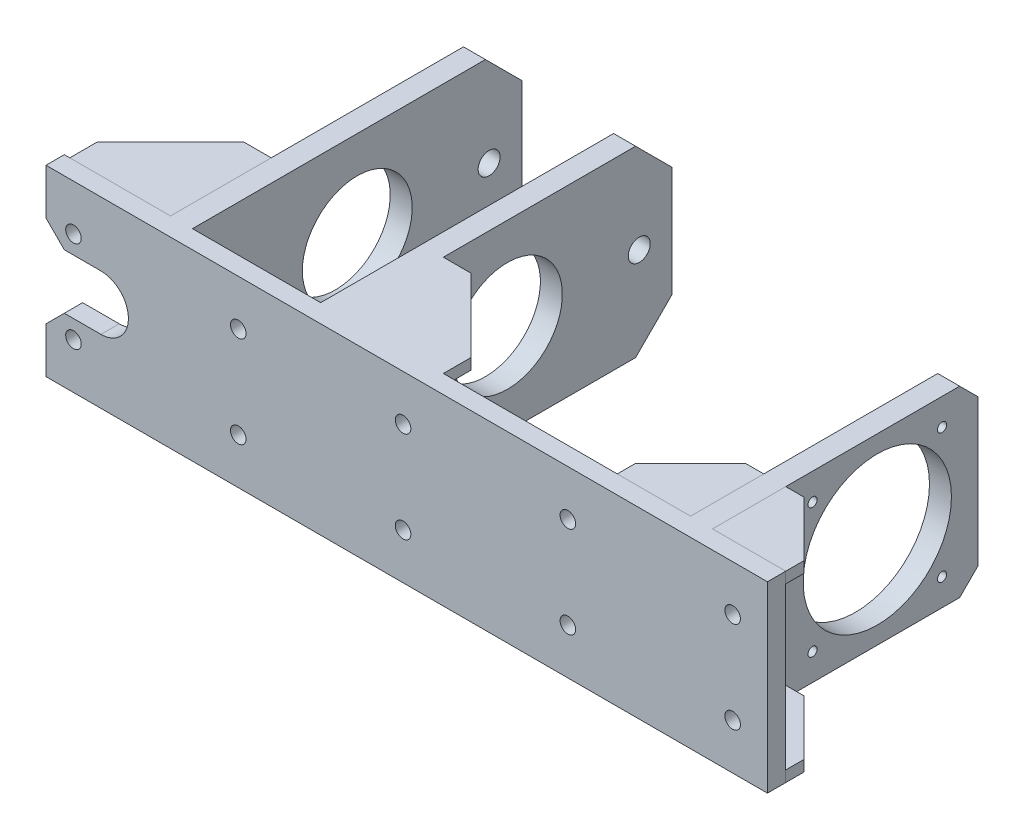
from build123d import *

# Parameters (mm, degrees)
SKETCH_1_W                   = 210
SKETCH_1_H                   = 100
EXTRUDE_1_DEPTH              = 10
SKETCH_2_W                   = 12
SKETCH_2_H                   = 100
EXTRUDE_2_DEPTH              = 180
HOLE_WIZARD_M10_1_D          = 8.5
HOLE_WIZARD_M10_1_DEPTH      = 24.5
HOLE_WIZARD_M10_1_TIP        = 2.553657631
SKETCH_6_R                   = 30
CUT_EXTRUDE_1_DEPTH          = 241.840195981
HOLE_WIZARD_M14_1_D          = 12
GUSSET_START                 = -50
GUSSET_1_DEPTH               = 6
GUSSET_START_2               = 44
GUSSET_2_DEPTH               = 6
CHAMFER_1_SIZE               = 20
SKETCH_11_W                  = 144
SKETCH_11_H                  = 100
EXTRUDE_3_DEPTH              = 10
SKETCH_12_W                  = 12
SKETCH_12_H                  = 100
EXTRUDE_4_DEPTH              = 145
SKETCH_14_R                  = 40.5
CUT_EXTRUDE_2_DEPTH          = 15
HOLE_WIZARD_M6_1_AT_2_COUNT  = 2
HOLE_WIZARD_M6_1_AT_2_PITCH  = 70.710678119
HOLE_WIZARD_M6_1_AT_3_COUNT  = 2
HOLE_WIZARD_M6_1_AT_3_PITCH  = 100
HOLE_WIZARD_M6_1_AT_4_COUNT  = 2
HOLE_WIZARD_M6_1_AT_4_PITCH  = 70.710678119
CHAMFER_2_SIZE               = 10
GUSSET_3_DEPTH               = 6
GUSSET_4_DEPTH               = 6
SKETCH_22_W                  = 10
SKETCH_22_H                  = 100
EXTRUDE_5_DEPTH              = 40
HOLE_WIZARD_M10_2_AT_2_COUNT = 2
HOLE_WIZARD_M10_2_AT_2_PITCH = 50
HOLE_WIZARD_M10_2_AT_3_COUNT = 2
HOLE_WIZARD_M10_2_AT_3_PITCH = 90
HOLE_WIZARD_M10_2_AT_4_COUNT = 2
HOLE_WIZARD_M10_2_AT_4_PITCH = 102.95630141
GUSSET_5_DEPTH               = 6
GUSSET_6_DEPTH               = 6
CUT_EXTRUDE_3_DEPTH          = 345.123524334
CHAMFER_3_SIZE               = 10


# Read off the part's stored shape, not the designer's step: 角撑板1, 角撑板2, 角撑板3, 角撑板4, 角撑板5, 角撑板6
with BuildPart() as part:
    # 草图1 → 凸台-拉伸1 (new body)
    with BuildSketch(Plane.XY):
        Rectangle(SKETCH_1_W, SKETCH_1_H)
    extrude(amount=EXTRUDE_1_DEPTH)

    # 草图2 → 凸台-拉伸2 (add)
    with BuildSketch(Plane(origin=(0, 0, 0), x_dir=(-1, 0, 0), z_dir=(0, 0, -1))):
        with Locations((41, 0)):
            Rectangle(SKETCH_2_W, SKETCH_2_H)
        with Locations((-41, 0)):
            Rectangle(SKETCH_2_W, SKETCH_2_H)
    extrude(amount=EXTRUDE_2_DEPTH)

    # M10 螺纹孔1
    with Locations(Plane.XY.offset(10)):
        with Locations((90, -25), (90, 25), (-90, -25), (-90, 25), (0, -25), (0, 25)):
            Hole(HOLE_WIZARD_M10_1_D / 2, depth=HOLE_WIZARD_M10_1_DEPTH)
            with Locations((0, 0, -(HOLE_WIZARD_M10_1_DEPTH + HOLE_WIZARD_M10_1_TIP / 2))):  # 118° drill point
                Cone(0, HOLE_WIZARD_M10_1_D / 2, HOLE_WIZARD_M10_1_TIP, mode=Mode.SUBTRACT)

    # 草图6 → 切除-拉伸1 (cut, through all)
    with BuildSketch(Plane.ZY.offset(47)):
        with Locations((-90, 0)):
            Circle(SKETCH_6_R)
    extrude(amount=-CUT_EXTRUDE_1_DEPTH, mode=Mode.SUBTRACT)

    # M14 螺纹孔1 (through all)
    with Locations(Plane.ZY.offset(47)):
        with Locations((-162, 0), (-18, 0)):
            Hole(HOLE_WIZARD_M14_1_D / 2)


with BuildPart() as body_2:
    # Gusset 1 outline → Gusset 1 (new body)
    with BuildSketch(Plane(origin=(0, 0, 0), x_dir=(1, 0, 0), z_dir=(0, 1, 0)).offset(GUSSET_START)):
        Polygon((-102, 15), (-102, 0), (-47, 0), (-47, 55), (-62, 55), align=None)
    gusset_1 = extrude(amount=GUSSET_1_DEPTH)


with BuildPart() as body_3:
    # Gusset 2 outline → Gusset 2 (new body)
    with BuildSketch(Plane(origin=(0, 0, 0), x_dir=(1, 0, 0), z_dir=(0, 1, 0)).offset(GUSSET_START_2)):
        Polygon((-47, 55), (-62, 55), (-102, 15), (-102, 0), (-47, 0), align=None)
    gusset_2 = extrude(amount=GUSSET_2_DEPTH)


with BuildPart() as part_1:
    add(part.part)

    # 镜向1: Gusset 1, Gusset 2 across plane
    add(gusset_1.mirror(Plane(origin=(0, 0, 0), x_dir=(0, 0, 1), z_dir=(1, 0, 0))))
    add(gusset_2.mirror(Plane(origin=(0, 0, 0), x_dir=(0, 0, 1), z_dir=(1, 0, 0))))

    # 倒角1
    chamfer_1_edges = [part_1.edges().sort_by_distance(p)[0] for p in [
        (41, 50, -180),
        (41, -50, -180),
        (-41, 50, -180),
        (-41, -50, -180),
    ]]
    chamfer(chamfer_1_edges, length=CHAMFER_1_SIZE)

    # 草图11 → 凸台-拉伸3 (add)
    with BuildSketch(Plane.XY.offset(10)):
        with Locations((177, 0)):
            Rectangle(SKETCH_11_W, SKETCH_11_H)
    extrude(amount=-EXTRUDE_3_DEPTH)

    # 草图12 → 凸台-拉伸4 (add)
    with BuildSketch(Plane(origin=(0, 0, 0), x_dir=(-1, 0, 0), z_dir=(0, 0, -1))):
        with Locations((-243, 0)):
            Rectangle(SKETCH_12_W, SKETCH_12_H)
    extrude(amount=EXTRUDE_4_DEPTH)

    # 草图14 → 切除-拉伸2 (cut)
    with BuildSketch(Plane(origin=(249, 0, 0), x_dir=(0, 0, -1), z_dir=(1, 0, 0))):
        with Locations((90, 0)):
            Circle(SKETCH_14_R)
    extrude(amount=-CUT_EXTRUDE_2_DEPTH, mode=Mode.SUBTRACT)

    # 草图17 → M6 螺纹孔1 (revolve, cut)
    with BuildSketch(Plane(origin=(249, -35.355339059, -125.355339059), x_dir=(0, 0, -1), z_dir=(0, 1, 0))):
        Polygon((0, 0), (0, 16.502151548), (2.5, 15), (2.5, 0), align=None)
    hole_wizard_m6_1 = revolve(axis=Axis((255.35, -35.355339059, -125.355339059), (-1, 0, 0)), mode=Mode.SUBTRACT)

    # M6 螺纹孔1 at 2: M6 螺纹孔1 ×2
    with Locations(*[(0, i * HOLE_WIZARD_M6_1_AT_2_PITCH, 0) for i in range(1, HOLE_WIZARD_M6_1_AT_2_COUNT)]):
        add(hole_wizard_m6_1, mode=Mode.SUBTRACT)

    # M6 螺纹孔1 at 3: M6 螺纹孔1 ×2
    with Locations(*[Vector(0, 0.7071067811865512, 0.7071067811865439) * (i * HOLE_WIZARD_M6_1_AT_3_PITCH) for i in range(1, HOLE_WIZARD_M6_1_AT_3_COUNT)]):
        add(hole_wizard_m6_1, mode=Mode.SUBTRACT)

    # M6 螺纹孔1 at 4: M6 螺纹孔1 ×2
    with Locations(*[(0, 0, i * HOLE_WIZARD_M6_1_AT_4_PITCH) for i in range(1, HOLE_WIZARD_M6_1_AT_4_COUNT)]):
        add(hole_wizard_m6_1, mode=Mode.SUBTRACT)

    # 倒角2
    chamfer_2_edges = [part_1.edges().sort_by_distance(p)[0] for p in [
        (243, -50, -145),
        (243, 50, -145),
    ]]
    chamfer(chamfer_2_edges, length=CHAMFER_2_SIZE)

    # 草图22 → 凸台-拉伸5 (add)
    with BuildSketch(Plane(origin=(249, 0, 0), x_dir=(0, 0, -1), z_dir=(1, 0, 0))):
        with Locations((-5, 0)):
            Rectangle(SKETCH_22_W, SKETCH_22_H)
    extrude(amount=EXTRUDE_5_DEPTH)

    # 草图20 → M10 螺纹孔2 (revolve, cut)
    with BuildSketch(Plane(origin=(180, 25, 10), x_dir=(0, -1, 0), z_dir=(1, 0, 0))):
        Polygon((0, 0), (0, 27.053657631), (4.25, 24.5), (4.25, 0), align=None)
    hole_wizard_m10_2 = revolve(axis=Axis((180, 25, 16.35), (0, 0, -1)), mode=Mode.SUBTRACT)

    # M10 螺纹孔2 at 2: M10 螺纹孔2 ×2
    with Locations(*[(0, -i * HOLE_WIZARD_M10_2_AT_2_PITCH, 0) for i in range(1, HOLE_WIZARD_M10_2_AT_2_COUNT)]):
        add(hole_wizard_m10_2, mode=Mode.SUBTRACT)

    # M10 螺纹孔2 at 3: M10 螺纹孔2 ×2
    with Locations(*[(i * HOLE_WIZARD_M10_2_AT_3_PITCH, 0, 0) for i in range(1, HOLE_WIZARD_M10_2_AT_3_COUNT)]):
        add(hole_wizard_m10_2, mode=Mode.SUBTRACT)

    # M10 螺纹孔2 at 4: M10 螺纹孔2 ×2
    with Locations(*[Vector(0.8741572761215379, -0.48564293117863194, 0) * (i * HOLE_WIZARD_M10_2_AT_4_PITCH) for i in range(1, HOLE_WIZARD_M10_2_AT_4_COUNT)]):
        add(hole_wizard_m10_2, mode=Mode.SUBTRACT)

    # 草图25 → 切除-拉伸3 (cut, through all)
    with BuildSketch(Plane(origin=(0, 0, 0), x_dir=(-1, 0, 0), z_dir=(0, 0, -1))):
        with BuildLine():
            Line((105, -15), (75, -15))
            ThreePointArc((75, -15), (60, 0), (75, 15))
            Line((75, 15), (105, 15))
            ThreePointArc((105, 15), (120, 0), (105, -15))
        make_face()
    extrude(amount=-CUT_EXTRUDE_3_DEPTH, mode=Mode.SUBTRACT)

    # 倒角3
    chamfer_3_edges = [part_1.edges().sort_by_distance(p)[0] for p in [
        (-105, 15, 5),
        (-105, -15, 5),
    ]]
    chamfer(chamfer_3_edges, length=CHAMFER_3_SIZE)


with BuildPart() as body_4:
    # Gusset 3 outline → Gusset 3 (new body)
    with BuildSketch(Plane(origin=(0, 0, 0), x_dir=(1, 0, 0), z_dir=(0, 1, 0)).offset(GUSSET_START)):
        Polygon((237, 40), (227, 40), (197, 10), (197, 0), (237, 0), align=None)
    extrude(amount=GUSSET_3_DEPTH)


with BuildPart() as body_5:
    # Gusset 4 outline → Gusset 4 (new body)
    with BuildSketch(Plane(origin=(0, 0, 0), x_dir=(1, 0, 0), z_dir=(0, 1, 0)).offset(GUSSET_START_2)):
        Polygon((237, 40), (227, 40), (197, 10), (197, 0), (237, 0), align=None)
    extrude(amount=GUSSET_4_DEPTH)


with BuildPart() as body_6:
    # Gusset 5 outline → Gusset 5 (new body)
    with BuildSketch(Plane(origin=(0, 0, 0), x_dir=(1, 0, 0), z_dir=(0, 1, 0)).offset(GUSSET_START)):
        Polygon((289, 0), (289, 10), (259, 40), (249, 40), (249, 0), align=None)
    extrude(amount=GUSSET_5_DEPTH)


with BuildPart() as body_7:
    # Gusset 6 outline → Gusset 6 (new body)
    with BuildSketch(Plane(origin=(0, 0, 0), x_dir=(1, 0, 0), z_dir=(0, 1, 0)).offset(GUSSET_START_2)):
        Polygon((259, 40), (249, 40), (249, 0), (289, 0), (289, 10), align=None)
    extrude(amount=GUSSET_6_DEPTH)


solid = Compound([body_2.part, body_3.part, part_1.part, body_4.part, body_5.part, body_6.part, body_7.part])
